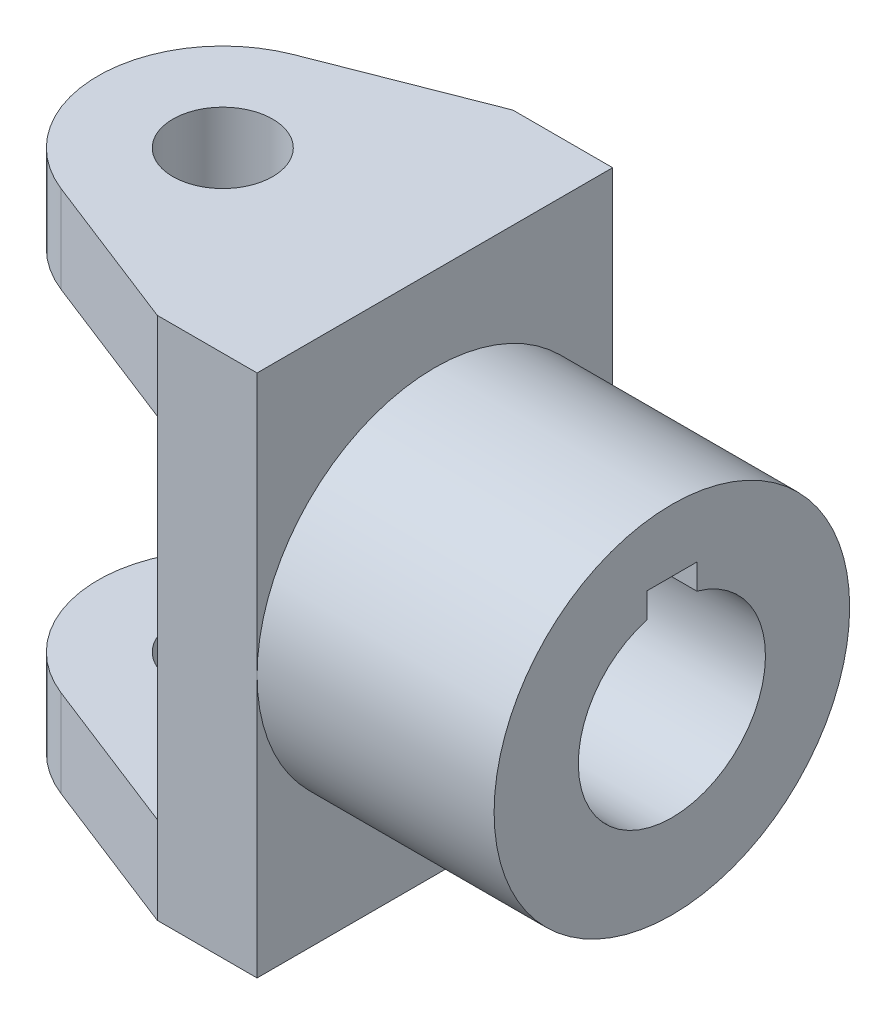
from build123d import *
from build123d.topology import SkipClean

# Parameters (mm, degrees)
SKETCH1_R           = 28.5
SKETCH1_R_2         = 15
BOSS_EXTRUDE1_DEPTH = 38
BOSS_EXTRUDE2_START = 16
SKETCH3_W           = 57
SKETCH3_H           = 84
SKETCH3_R           = 15
BOSS_EXTRUDE2_DEPTH = 16
BOSS_EXTRUDE3_DEPTH = 84
CUT_EXTRUDE1_DEPTH  = 28
SKETCH7_W           = 8
SKETCH7_H           = 7
CUT_EXTRUDE2_DEPTH  = 106.072593953


with BuildPart() as part:
    # Sketch1 → Boss-Extrude1 (new body)
    with BuildSketch(Plane(origin=(0, 0, 0), x_dir=(0, 0, -1), z_dir=(1, 0, 0))):
        Circle(SKETCH1_R)
        Circle(SKETCH1_R_2, mode=Mode.SUBTRACT)
    extrude(amount=BOSS_EXTRUDE1_DEPTH)

    # Sketch3 → Boss-Extrude2 (add)
    with SkipClean():  # the faces are left unmerged after this step: merging them gives an invalid solid
        with BuildSketch(Plane.ZY.offset(BOSS_EXTRUDE2_START)):
            Rectangle(SKETCH3_W, SKETCH3_H)
            Circle(SKETCH3_R, mode=Mode.SUBTRACT)
        extrude(amount=-BOSS_EXTRUDE2_DEPTH)

    # Sketch4 → Boss-Extrude3 (add)
    with SkipClean():  # the faces are left unmerged after this step: merging them gives an invalid solid
        with BuildSketch(Plane(origin=(0, 42, 0), x_dir=(1, 0, 0), z_dir=(0, 1, 0))):
            with BuildLine():
                Line((-16, 0), (-16, 28.5))
                Line((-16, 28.5), (-41.275105345, 18.629891095))
                ThreePointArc((-41.275105345, 18.629891095), (-50.515176458, 11.280467479), (-54, 0))
                Line((-54, 0), (-42, 0))
                ThreePointArc((-42, 0), (-34, 8), (-26, 0))
                Line((-26, 0), (-16, 0))
            make_face()
            with BuildLine():
                Line((-16, -28.5), (-16, 0))
                Line((-16, 0), (-26, 0))
                ThreePointArc((-26, 0), (-34, -8), (-42, 0))
                Line((-42, 0), (-54, 0))
                ThreePointArc((-54, 0), (-50.515176458, -11.280467479), (-41.275105345, -18.629891095))
                Line((-41.275105345, -18.629891095), (-16, -28.5))
            make_face()
        extrude(amount=-BOSS_EXTRUDE3_DEPTH)

    # Sketch5 → Cut-Extrude1 (cut, symmetric)
    with SkipClean():  # the faces are left unmerged after this step: merging them gives an invalid solid
        with BuildSketch(Plane(origin=(0, 0, 0), x_dir=(1, 0, 0), z_dir=(0, 1, 0))):
            with BuildLine():
                Line((-16, 28.5), (-41.275105345, 18.629891095))
                ThreePointArc((-41.275105345, 18.629891095), (-54, 0), (-41.275105345, -18.629891095))
                Line((-41.275105345, -18.629891095), (-16, -28.5))
                Line((-16, -28.5), (-16, 28.5))
            make_face()
        extrude(amount=CUT_EXTRUDE1_DEPTH, both=True, mode=Mode.SUBTRACT)

    # Sketch7 → Cut-Extrude2 (cut, through all)
    with SkipClean():  # the faces are left unmerged after this step: merging them gives an invalid solid
        with BuildSketch(Plane(origin=(38, 0, 0), x_dir=(0, 0, -1), z_dir=(1, 0, 0))):
            with Locations((0, 15)):
                Rectangle(SKETCH7_W, SKETCH7_H)
        extrude(amount=-CUT_EXTRUDE2_DEPTH, mode=Mode.SUBTRACT)
    add(part.part.scale(1), mode=Mode.REPLACE)  # the faces are merged on a copy


solid = part.part
